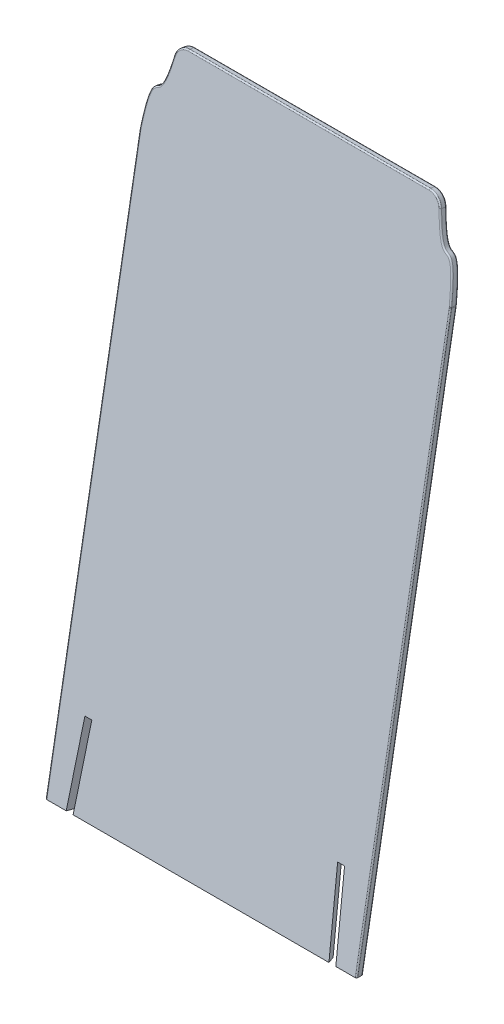
from build123d import *

# Parameters (mm, degrees)
BOSS_EXTRUDE1_DEPTH = 609.6
SKETCH2_W           = 152.4
SKETCH2_H           = 12.7
CUT_EXTRUDE1_DEPTH  = 609.6
SKETCH3_W           = 152.4
SKETCH3_H           = 12.7
CUT_EXTRUDE2_DEPTH  = 609.6
CUT_EXTRUDE3_DEPTH  = 50.8
FILLET1_R           = 25.4
FILLET2_R           = 2.54


with BuildPart() as part:
    # Sketch1 → Boss-Extrude1 (new body)
    with BuildSketch(Plane(origin=(0, 0, 0), x_dir=(0, 0, -1), z_dir=(1, 0, 0))):
        Polygon((0, 0), (211.711858212, 1200.677612472), (224.218916675, 1198.472280616), (12.895917971, 0), align=None)
    extrude(amount=BOSS_EXTRUDE1_DEPTH)

    # Sketch2 → Cut-Extrude1 (cut)
    with BuildSketch(Plane(origin=(0, 0, 0), x_dir=(0, -1, 0), z_dir=(-0.34202014332566943, 0, 0.9396926207859081))):
        with Locations((-76.2, 44.45)):
            Rectangle(SKETCH2_W, SKETCH2_H)
    extrude(amount=-CUT_EXTRUDE1_DEPTH, mode=Mode.SUBTRACT)

    # Sketch3 → Cut-Extrude2 (cut)
    with BuildSketch(Plane(origin=(71.309653737, 0, 195.921663432), x_dir=(0, 1, 0), z_dir=(0.34202014332566943, 0, 0.9396926207859081))):
        with Locations((76.2, -528.386621631)):
            Rectangle(SKETCH3_W, SKETCH3_H)
    extrude(amount=-CUT_EXTRUDE2_DEPTH, mode=Mode.SUBTRACT)

    # Sketch4 → Cut-Extrude3 (cut)
    with BuildSketch(Plane(origin=(0, 0, 0), x_dir=(1, 0, 0), z_dir=(0, 0.17364817766692348, 0.9848077530122092))):
        with BuildLine():
            Line((0, 1061.843909453), (0, 1219.2))
            Line((0, 1219.2), (47.534912474, 1219.2))
            add(Edge.make_bspline(
                [(0, 1061.843909453), (8.114972457, 1176.48682206), (23.030625436, 1126.057709606), (31.55385571, 1123.216632848), (47.534912474, 1219.2)],
                knots=[0, 0, 0, 0, 0, 1, 1, 1, 1, 1], degree=4))
        make_face()
        with BuildLine():
            Line((609.6, 1061.843909453), (609.6, 1219.2))
            Line((609.6, 1219.2), (562.065087526, 1219.2))
            add(Edge.make_bspline(
                [(609.6, 1061.843909453), (601.485027543, 1176.48682206), (586.569374564, 1126.057709606), (578.04614429, 1123.216632848), (562.065087526, 1219.2)],
                knots=[0, 0, 0, 0, 0, 1, 1, 1, 1, 1], degree=4))
        make_face()
    extrude(amount=-CUT_EXTRUDE3_DEPTH, mode=Mode.SUBTRACT)

    # Fillet1
    # the kernel refuses this fillet: 25.4 mm, written as the material it takes off along each edge
    with BuildSketch(Plane(origin=(609.6, 1045.712114518, -184.387259843), x_dir=(-0.07108974735561036, 0.9823161138291641, -0.17320883445276225), z_dir=(0, -0.1736481776669235, -0.9848077530122094))) as fillet1_piece_1:
        with BuildLine():
            CenterArc((0.90402546, -25.399997), FILLET1_R, 89.972152416, 4.104428675)
            Line((-0.901654123, -0.064260949), (-0.937767715, 0.442453772))
            Line((-0.937767715, 0.442453772), (-0.036113592, 0.506714721))
            Line((-0.036113592, 0.506714721), (-0.000245292, 0.507999941))
            ThreePointArc((-0.000245292, 0.507999941), (0.458184933, 0.508110981), (0.916617577, 0.50799994))
            Line((0.916617577, 0.50799994), (0.916370673, 0))
        make_face()
    extrude(amount=12.7, mode=Mode.SUBTRACT)
    with BuildSketch(Plane(origin=(562.065087526, 1200.677612472, -211.711858212), x_dir=(-1, 0, 0), z_dir=(0, -0.1736481776669235, -0.9848077530122094))) as fillet1_piece_2:
        with BuildLine():
            CenterArc((21.321847162, -25.4), FILLET1_R, 90, 79.38997145)
            Line((-3.643892514, -20.723265839), (-4.143207308, -20.629731156))
            ThreePointArc((-4.143207308, -20.629731156), (-2.270535196, -10.282989475), (-0.501101797, 0.083432541))
            Line((-0.501101797, 0.083432541), (0, 0.508))
            Line((0, 0.508), (21.321847162, 0.508))
            Line((21.321847162, 0.508), (21.321847162, 0))
        make_face()
    extrude(amount=12.7, mode=Mode.SUBTRACT)
    with BuildSketch(Plane(origin=(0, 1045.712114518, -184.387259843), x_dir=(0, -0.9848077530122092, 0.17364817766692348), z_dir=(0, -0.1736481776669235, -0.9848077530122094))) as fillet1_piece_3:
        with BuildLine():
            CenterArc((0.903941164, -25.4), FILLET1_R, 90, 4.104428675)
            Line((-0.914052185, -0.06514456), (-0.950412052, 0.441552549))
            ThreePointArc((-0.950412052, 0.441552549), (-0.493147171, 0.47425317), (-0.035868916, 0.5067321))
            Line((-0.035868916, 0.5067321), (0, 0.508))
            Line((0, 0.508), (0.903941164, 0.508))
            Line((0.903941164, 0.508), (0.903941164, 0))
        make_face()
    extrude(amount=12.7, mode=Mode.SUBTRACT)
    with BuildSketch(Plane(origin=(47.534912474, 1200.677612472, -211.711858212), x_dir=(-0.17317900837409472, -0.9699276673133911, 0.17102441708296778), z_dir=(0, -0.1736481776669235, -0.9848077530122094))) as fillet1_piece_4:
        with BuildLine():
            CenterArc((21.323718923, -25.398428647), FILLET1_R, 90.637323514, 79.38997145)
            Line((-3.692496348, -20.999681834), (-4.192820654, -20.911706898))
            Line((-4.192820654, -20.911706898), (-0.500324305, 0.087974936))
            Line((-0.500324305, 0.087974936), (0.004608406, 0.507979097))
            ThreePointArc((0.004608406, 0.507979097), (10.520826291, 0.455430317), (21.035539981, 0.507968573))
            Line((21.035539981, 0.507968573), (21.041190548, 0))
        make_face()
    extrude(amount=12.7, mode=Mode.SUBTRACT)

    # Fillet2
    fillet2_edges = [part.edges().sort_by_distance(p)[0] for p in [
        (609.6, 522.410953126, -92.115146054),
        (304.8, 1200.677612472, -211.711858212),
        (13.979986428, 1117.233411662, -196.998394225),
        (0, 522.410953126, -92.115146054),
        (595.620013572, 1117.233411662, -196.998394225),
        (52.633767429, 1194.910744248, -210.695003749),
        (0.016291364, 1045.717667759, -184.388239029),
        (556.966232571, 1194.910744248, -210.695003749),
        (609.583708636, 1045.717667759, -184.388239029),
        (595.622751821, 1115.024845853, -209.504882455),
        (13.977248179, 1115.024845853, -209.504882455),
        (304.8, 1198.472280616, -224.218916675),
        (52.633767429, 1192.705412392, -223.202062213),
        (0.016291364, 1043.512335902, -196.895297493),
        (556.966232571, 1192.705412392, -223.202062213),
        (609.583708636, 1043.512335902, -196.895297493),
        (0, 521.308287198, -104.816634271),
        (609.6, 521.308287198, -104.816634271),
    ]]
    fillet(fillet2_edges, radius=FILLET2_R)


solid = part.part
